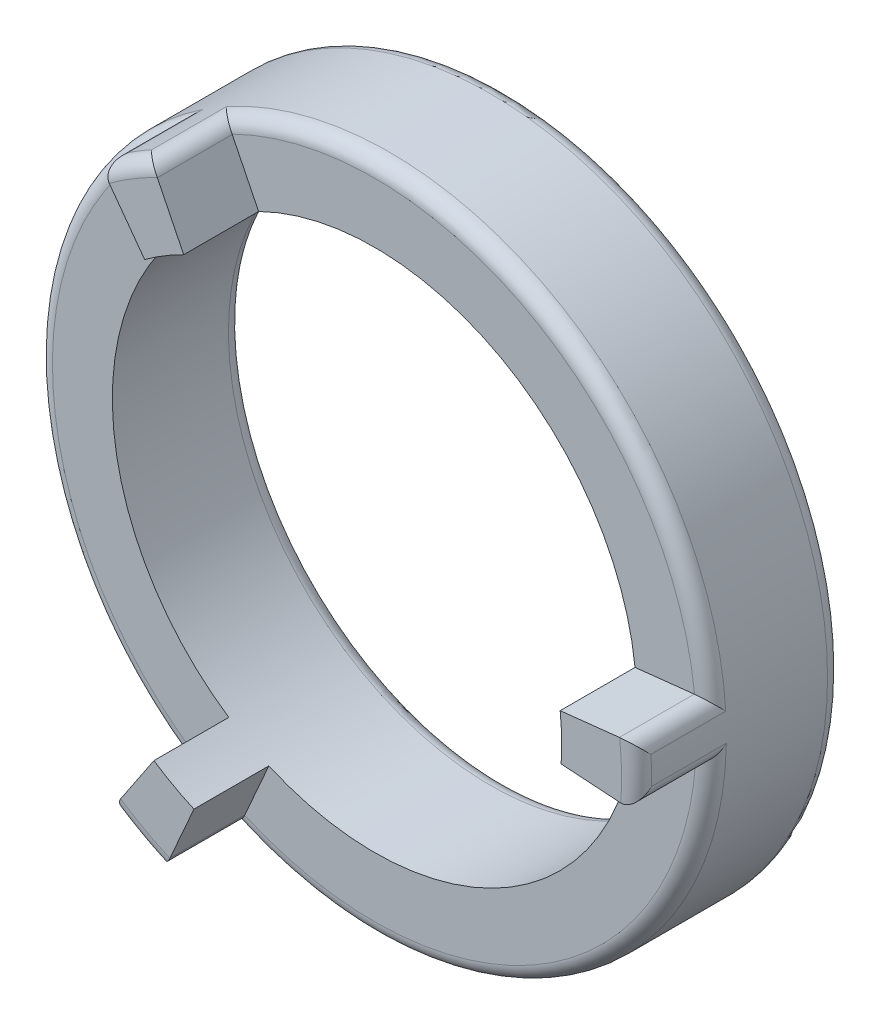
from build123d import *

# Parameters (mm, degrees)
SKETCH_1_R               = 4.5
EXTRUDE_1_DEPTH          = 1.75
SKETCH_2_R               = 3.5
CUT_EXTRUDE_1_DEPTH      = 1.75
EXTRUDE_2_DEPTH          = 1
PATTERN_CIRCULAR_2_COUNT = 3
FILLET_1_R               = 0.2


with BuildPart() as part:
    # 草图1 → 凸台-拉伸1 (new body)
    with BuildSketch(Plane.XY):
        Circle(SKETCH_1_R)
    extrude(amount=EXTRUDE_1_DEPTH)

    # 草图2 → 切除-拉伸1 (cut)
    with BuildSketch(Plane(origin=(0, 0, 0), x_dir=(-1, 0, 0), z_dir=(0, 0, -1))):
        Circle(SKETCH_2_R)
    extrude(amount=-CUT_EXTRUDE_1_DEPTH, mode=Mode.SUBTRACT)

    # 草图3 → 凸台-拉伸2 (add)
    with BuildSketch(Plane.XY.offset(1.75)):
        with BuildLine():
            Line((-1.54722844, 3.139440102), (-1.989293708, 4.036422988))
            ThreePointArc((-1.989293708, 4.036422988), (-2.333521289, 3.84768481), (-2.659989363, 3.629663426))
            Line((-2.659989363, 3.629663426), (-2.068880616, 2.823071554))
            ThreePointArc((-2.068880616, 2.823071554), (-1.814961002, 2.992643741), (-1.54722844, 3.139440102))
        make_face()
    extrude_2 = extrude(amount=EXTRUDE_2_DEPTH)

    # 阵列(圆周)2: 凸台-拉伸2 ×3 about axis
    pattern_circular_2_axis = Axis((0, 0, 0), (0, 0, 1))
    for i in range(1, PATTERN_CIRCULAR_2_COUNT):
        add(extrude_2.rotate(pattern_circular_2_axis, i * 360 / PATTERN_CIRCULAR_2_COUNT))

    # 圆角1
    # the kernel refuses this fillet: 0.2 mm, written as the material it takes off along each edge
    with BuildSketch(Plane(origin=(0, 0, 1.75), x_dir=(-0.5911087473826521, 0.8065918724904882, 0), z_dir=(0.8065918724904882, 0.5911087473826521, 0))) as fillet_1_piece_1:
        with BuildLine():
            CenterArc((4.5 - FILLET_1_R, -FILLET_1_R), FILLET_1_R, 0, 90)
            Line((4.5 - FILLET_1_R, 0), (4.5, 0))
            Line((4.5, 0), (4.5, -FILLET_1_R))
        make_face()
    revolve(axis=Axis((0, 0, 1.75), (0, 0, 1)), revolution_arc=110, mode=Mode.SUBTRACT)
    with BuildSketch(Plane(origin=(-1.989293708, 4.036422988, 1.75), x_dir=(-0.8864567929305034, -0.4628113592678625, 0), z_dir=(0, 0, 1)), Plane(origin=(4.490291703, -0.295432607, 1.75), x_dir=(0.042422002179279744, 0.9990997816690289, 0), z_dir=(0, 0, 1)), Plane(origin=(-2.500997994, -3.740990381, 1.75), x_dir=(0.8440347907512271, -0.5362884224011667, 0), z_dir=(0, 0, 1))) as fillet_1_piece_2:
        with BuildLine():
            CenterArc((0.204706556, 0.19994588), FILLET_1_R, 178.667059118, 92.665881765)
            Line((0.004760676, 0.204598302), (0, 0))
            ThreePointArc((0, 0), (0.104679489, -0.001217698), (0.209358978, 0))
        make_face()
    extrude(amount=1.523397445, mode=Mode.SUBTRACT)
    with BuildSketch(Plane(origin=(-2.659989363, 3.629663426, 1.75), x_dir=(0.820124045079819, 0.5721857658854467, 0), z_dir=(0, 0, 1)), Plane(origin=(4.473375416, 0.488786649, 1.75), x_dir=(0.08546538640074963, -0.9963411402362999, 0), z_dir=(0, 0, 1)), Plane(origin=(-1.813386053, -4.118450075, 1.75), x_dir=(-0.905589431480564, 0.4241553743508489, 0), z_dir=(0, 0, 1))) as fillet_1_piece_3:
        with BuildLine():
            CenterArc((0.204706556, -0.19994588), FILLET_1_R, 88.667059118, 92.665881765)
            Line((0.004760676, -0.204598302), (0, 0))
            ThreePointArc((0, 0), (0.104679489, 0.001217698), (0.209358978, 0))
        make_face()
    extrude(amount=1.523397445, mode=Mode.SUBTRACT)
    with BuildSketch(Plane(origin=(0, 0, 2.75), x_dir=(-0.3398789385562205, 0.9404691952030628, 0), z_dir=(0.9404691952030628, 0.3398789385562205, 0))) as fillet_1_piece_4:
        with BuildLine():
            CenterArc((4.5 - FILLET_1_R, -FILLET_1_R), FILLET_1_R, 0, 90)
            Line((4.5 - FILLET_1_R, 0), (4.5, 0))
            Line((4.5, 0), (4.5, -FILLET_1_R))
        make_face()
    revolve(axis=Axis((0, 0, 2.75), (0, 0, 1)), revolution_arc=22.732458574, mode=Mode.SUBTRACT)
    with BuildSketch(Plane(origin=(0, 0, 0), x_dir=(1, 0, 0), z_dir=(0, -1, 0))) as fillet_1_piece_5:
        with BuildLine():
            CenterArc((4.5 - FILLET_1_R, FILLET_1_R), FILLET_1_R, 270, 90)
            Line((4.5 - FILLET_1_R, 0), (4.5, 0))
            Line((4.5, 0), (4.5, FILLET_1_R))
        make_face()
    revolve(axis=Axis((0, 0, 0), (0, 0, 1)), mode=Mode.SUBTRACT)
    with BuildSketch(Plane(origin=(0, 0, 1.75), x_dir=(0.9940834257541477, 0.1086192553873306, 0), z_dir=(0.1086192553873306, -0.9940834257541477, 0))) as fillet_1_piece_6:
        with BuildLine():
            CenterArc((4.5 - FILLET_1_R, -FILLET_1_R), FILLET_1_R, 0, 90)
            Line((4.5 - FILLET_1_R, 0), (4.5, 0))
            Line((4.5, 0), (4.5, -FILLET_1_R))
        make_face()
    revolve(axis=Axis((0, 0, 1.75), (0, 0, 1)), revolution_arc=110, mode=Mode.SUBTRACT)
    with BuildSketch(Plane(origin=(0, 0, 2.75), x_dir=(0.9844096838006688, -0.17589080260055465, 0), z_dir=(-0.17589080260055465, -0.9844096838006688, 0))) as fillet_1_piece_7:
        with BuildLine():
            CenterArc((4.5 - FILLET_1_R, -FILLET_1_R), FILLET_1_R, 0, 90)
            Line((4.5 - FILLET_1_R, 0), (4.5, 0))
            Line((4.5, 0), (4.5, -FILLET_1_R))
        make_face()
    revolve(axis=Axis((0, 0, 2.75), (0, 0, 1)), revolution_arc=22.732458574, mode=Mode.SUBTRACT)
    with BuildSketch(Plane(origin=(0, 0, 1.75), x_dir=(-0.40297467837149564, -0.9152111278778191, 0), z_dir=(-0.9152111278778191, 0.40297467837149564, 0))) as fillet_1_piece_8:
        with BuildLine():
            CenterArc((4.5 - FILLET_1_R, -FILLET_1_R), FILLET_1_R, 0, 90)
            Line((4.5 - FILLET_1_R, 0), (4.5, 0))
            Line((4.5, 0), (4.5, -FILLET_1_R))
        make_face()
    revolve(axis=Axis((0, 0, 1.75), (0, 0, 1)), revolution_arc=110, mode=Mode.SUBTRACT)
    with BuildSketch(Plane(origin=(0, 0, 2.75), x_dir=(-0.6445307452444484, -0.7645783926025087, 0), z_dir=(-0.7645783926025087, 0.6445307452444484, 0))) as fillet_1_piece_9:
        with BuildLine():
            CenterArc((4.5 - FILLET_1_R, -FILLET_1_R), FILLET_1_R, 0, 90)
            Line((4.5 - FILLET_1_R, 0), (4.5, 0))
            Line((4.5, 0), (4.5, -FILLET_1_R))
        make_face()
    revolve(axis=Axis((0, 0, 2.75), (0, 0, 1)), revolution_arc=22.732458574, mode=Mode.SUBTRACT)
    with BuildSketch(Plane(origin=(0, 0, 0), x_dir=(-1, 0, 0), z_dir=(0, -1, 0))) as fillet_1_piece_10:
        with BuildLine():
            CenterArc((3.5 + FILLET_1_R, -FILLET_1_R), FILLET_1_R, 90, 90)
            Line((3.5, -FILLET_1_R), (3.5, 0))
            Line((3.5, 0), (3.5 + FILLET_1_R, 0))
        make_face()
    revolve(axis=Axis((0, 0, 0), (0, 0, -1)), mode=Mode.SUBTRACT)
    with BuildSketch(Plane(origin=(-2.659989363, 3.629663426, 1.226602555), x_dir=(0.8201240450798175, 0.5721857658854486, 0), z_dir=(0, 0, 1))) as fillet_1_piece_11a_section:
        with BuildLine():
            CenterArc((0.204706556, -0.19994588), FILLET_1_R, 88.667059118, 92.665881765)
            Line((0.004760676, -0.204598302), (0, 0))
            ThreePointArc((0, 0), (0.104679489, 0.001217698), (0.209358978, 0))
        make_face()
    fillet_1_piece_11a = extrude(amount=2.04679489, mode=Mode.PRIVATE)
    fillet_1_piece_11a = split(fillet_1_piece_11a, bisect_by=Plane(origin=(-2.59395086, 3.620118338, 1.75), z_dir=(0, 0, -1)), keep=Keep.TOP, mode=Mode.PRIVATE)
    with BuildSketch(Plane(origin=(0, 0, 1.75), x_dir=(-0.4979688255106006, 0.8671949312695462, 0), z_dir=(0.8671949312695462, 0.4979688255106006, 0))) as fillet_1_piece_11b_section:
        with BuildLine():
            CenterArc((4.5 - FILLET_1_R, -FILLET_1_R), FILLET_1_R, 0, 90)
            Line((4.5 - FILLET_1_R, 0), (4.5, 0))
            Line((4.5, 0), (4.5, -FILLET_1_R))
        make_face()
    fillet_1_piece_11b = revolve(axis=Axis((0, 0, 1.75), (0, 0, 1)), revolution_arc=116.370018498, mode=Mode.PRIVATE)
    fillet_1_piece_11b = split(fillet_1_piece_11b, bisect_by=Plane(origin=(-2.628049402, 3.586080053, 1.704474437), z_dir=(0.8065918724904881, 0.5911087473826522, 0)), keep=Keep.TOP, mode=Mode.PRIVATE)
    fillet_1_piece_11 = fillet_1_piece_11a & fillet_1_piece_11b
    add(fillet_1_piece_11, mode=Mode.SUBTRACT)
    with BuildSketch(Plane(origin=(0, 0, 1.75), x_dir=(-0.5911087473826521, 0.8065918724904882, 0), z_dir=(0.8065918724904882, 0.5911087473826521, 0))) as fillet_1_piece_12a_section:
        with BuildLine():
            CenterArc((4.5 - FILLET_1_R, -FILLET_1_R), FILLET_1_R, 0, 90)
            Line((4.5 - FILLET_1_R, 0), (4.5, 0))
            Line((4.5, 0), (4.5, -FILLET_1_R))
        make_face()
    fillet_1_piece_12a = revolve(axis=Axis((0, 0, 1.75), (0, 0, 1)), revolution_arc=116.370018498, mode=Mode.PRIVATE)
    fillet_1_piece_12a = split(fillet_1_piece_12a, bisect_by=Plane(origin=(-2.47096713, -3.696070243, 1.704474437), z_dir=(0.8313311958319957, -0.5557773320643297, 0)), keep=Keep.TOP, mode=Mode.PRIVATE)
    with BuildSketch(Plane(origin=(-2.500997994, -3.740990381, 1.226602555), x_dir=(0.8440347907512287, -0.5362884224011644, 0), z_dir=(0, 0, 1))) as fillet_1_piece_12b_section:
        with BuildLine():
            CenterArc((0.204706556, 0.19994588), FILLET_1_R, 178.667059118, 92.665881765)
            Line((0.004760676, 0.204598302), (0, 0))
            ThreePointArc((0, 0), (0.104679489, -0.001217698), (0.209358978, 0))
        make_face()
    fillet_1_piece_12b = extrude(amount=2.04679489, mode=Mode.PRIVATE)
    fillet_1_piece_12b = split(fillet_1_piece_12b, bisect_by=Plane(origin=(-2.435432519, -3.728606481, 1.75), z_dir=(0, 0, -1)), keep=Keep.TOP, mode=Mode.PRIVATE)
    fillet_1_piece_12 = fillet_1_piece_12a & fillet_1_piece_12b
    add(fillet_1_piece_12, mode=Mode.SUBTRACT)
    with BuildSketch(Plane(origin=(0, 0, 1.75), x_dir=(0.9940834257541477, 0.1086192553873306, 0), z_dir=(0.1086192553873306, -0.9940834257541477, 0))) as fillet_1_piece_13a_section:
        with BuildLine():
            CenterArc((4.5 - FILLET_1_R, -FILLET_1_R), FILLET_1_R, 0, 90)
            Line((4.5 - FILLET_1_R, 0), (4.5, 0))
            Line((4.5, 0), (4.5, -FILLET_1_R))
        make_face()
    fillet_1_piece_13a = revolve(axis=Axis((0, 0, 1.75), (0, 0, 1)), revolution_arc=116.370018498, mode=Mode.PRIVATE)
    fillet_1_piece_13a = split(fillet_1_piece_13a, bisect_by=Plane(origin=(-1.96540716, 3.987955428, 1.704474437), z_dir=(-0.8969828863312469, -0.44206526851683975, 0)), keep=Keep.TOP, mode=Mode.PRIVATE)
    with BuildSketch(Plane(origin=(-1.989293708, 4.036422988, 1.226602555), x_dir=(-0.886456792930503, -0.4628113592678634, 0), z_dir=(0, 0, 1))) as fillet_1_piece_13b_section:
        with BuildLine():
            CenterArc((0.204706556, 0.19994588), FILLET_1_R, 178.667059118, 92.665881765)
            Line((0.004760676, 0.204598302), (0, 0))
            ThreePointArc((0, 0), (0.104679489, -0.001217698), (0.209358978, 0))
        make_face()
    fillet_1_piece_13b = extrude(amount=2.04679489, mode=Mode.PRIVATE)
    fillet_1_piece_13b = split(fillet_1_piece_13b, bisect_by=Plane(origin=(-2.011351674, 3.973449671, 1.75), z_dir=(0, 0, -1)), keep=Keep.TOP, mode=Mode.PRIVATE)
    fillet_1_piece_13 = fillet_1_piece_13a & fillet_1_piece_13b
    add(fillet_1_piece_13, mode=Mode.SUBTRACT)
    with BuildSketch(Plane(origin=(4.473375416, 0.488786649, 1.226602555), x_dir=(0.0854653864007455, -0.9963411402363004, 0), z_dir=(0, 0, 1))) as fillet_1_piece_14a_section:
        with BuildLine():
            CenterArc((0.204706556, -0.19994588), FILLET_1_R, 88.667059118, 92.665881765)
            Line((0.004760676, -0.204598302), (0, 0))
            ThreePointArc((0, 0), (0.104679489, 0.001217698), (0.209358978, 0))
        make_face()
    fillet_1_piece_14a = extrude(amount=2.04679489, mode=Mode.PRIVATE)
    fillet_1_piece_14a = split(fillet_1_piece_14a, bisect_by=Plane(origin=(4.432089875, 0.436368172, 1.75), z_dir=(0, 0, -1)), keep=Keep.TOP, mode=Mode.PRIVATE)
    with BuildSketch(Plane(origin=(0, 0, 1.75), x_dir=(0.9999972532678275, -0.0023438124498927643, 0), z_dir=(-0.0023438124498927643, -0.9999972532678275, 0))) as fillet_1_piece_14b_section:
        with BuildLine():
            CenterArc((4.5 - FILLET_1_R, -FILLET_1_R), FILLET_1_R, 0, 90)
            Line((4.5 - FILLET_1_R, 0), (4.5, 0))
            Line((4.5, 0), (4.5, -FILLET_1_R))
        make_face()
    fillet_1_piece_14b = revolve(axis=Axis((0, 0, 1.75), (0, 0, 1)), revolution_arc=116.370018498, mode=Mode.PRIVATE)
    fillet_1_piece_14b = split(fillet_1_piece_14b, bisect_by=Plane(origin=(4.419661127, 0.482917518, 1.704474437), z_dir=(0.10861925538733055, -0.9940834257541478, 0)), keep=Keep.TOP, mode=Mode.PRIVATE)
    fillet_1_piece_14 = fillet_1_piece_14a & fillet_1_piece_14b
    add(fillet_1_piece_14, mode=Mode.SUBTRACT)
    with BuildSketch(Plane(origin=(4.490291703, -0.295432607, 1.226602555), x_dir=(0.04242200217927562, 0.999099781669029, 0), z_dir=(0, 0, 1))) as fillet_1_piece_15a_section:
        with BuildLine():
            CenterArc((0.204706556, 0.19994588), FILLET_1_R, 178.667059118, 92.665881765)
            Line((0.004760676, 0.204598302), (0, 0))
            ThreePointArc((0, 0), (0.104679489, -0.001217698), (0.209358978, 0))
        make_face()
    fillet_1_piece_15a = extrude(amount=2.04679489, mode=Mode.PRIVATE)
    fillet_1_piece_15a = split(fillet_1_piece_15a, bisect_by=Plane(origin=(4.446784193, -0.24484319, 1.75), z_dir=(0, 0, -1)), keep=Keep.TOP, mode=Mode.PRIVATE)
    with BuildSketch(Plane(origin=(0, 0, 1.75), x_dir=(-0.40297467837149564, -0.9152111278778191, 0), z_dir=(-0.9152111278778191, 0.40297467837149564, 0))) as fillet_1_piece_15b_section:
        with BuildLine():
            CenterArc((4.5 - FILLET_1_R, -FILLET_1_R), FILLET_1_R, 0, 90)
            Line((4.5 - FILLET_1_R, 0), (4.5, 0))
            Line((4.5, 0), (4.5, -FILLET_1_R))
        make_face()
    fillet_1_piece_15b = revolve(axis=Axis((0, 0, 1.75), (0, 0, 1)), revolution_arc=116.370018498, mode=Mode.PRIVATE)
    fillet_1_piece_15b = split(fillet_1_piece_15b, bisect_by=Plane(origin=(4.43637429, -0.291885185, 1.704474437), z_dir=(0.06565169049925154, 0.9978426005811692, 0)), keep=Keep.TOP, mode=Mode.PRIVATE)
    fillet_1_piece_15 = fillet_1_piece_15a & fillet_1_piece_15b
    add(fillet_1_piece_15, mode=Mode.SUBTRACT)
    with BuildSketch(Plane(origin=(0, 0, 1.75), x_dir=(-0.5020284277572276, -0.8648511188196534, 0), z_dir=(-0.8648511188196534, 0.5020284277572276, 0))) as fillet_1_piece_16a_section:
        with BuildLine():
            CenterArc((4.5 - FILLET_1_R, -FILLET_1_R), FILLET_1_R, 0, 90)
            Line((4.5 - FILLET_1_R, 0), (4.5, 0))
            Line((4.5, 0), (4.5, -FILLET_1_R))
        make_face()
    fillet_1_piece_16a = revolve(axis=Axis((0, 0, 1.75), (0, 0, 1)), revolution_arc=116.370018498, mode=Mode.PRIVATE)
    fillet_1_piece_16a = split(fillet_1_piece_16a, bisect_by=Plane(origin=(-1.791611725, -4.068997571, 1.704474437), z_dir=(-0.9152111278778191, 0.40297467837149553, 0)), keep=Keep.TOP, mode=Mode.PRIVATE)
    with BuildSketch(Plane(origin=(-1.813386053, -4.118450075, 1.226602555), x_dir=(-0.9055894314805639, 0.4241553743508493, 0), z_dir=(0, 0, 1))) as fillet_1_piece_16b_section:
        with BuildLine():
            CenterArc((0.204706556, -0.19994588), FILLET_1_R, 88.667059118, 92.665881765)
            Line((0.004760676, -0.204598302), (0, 0))
            ThreePointArc((0, 0), (0.104679489, 0.001217698), (0.209358978, 0))
        make_face()
    fillet_1_piece_16b = extrude(amount=2.04679489, mode=Mode.PRIVATE)
    fillet_1_piece_16b = split(fillet_1_piece_16b, bisect_by=Plane(origin=(-1.838139015, -4.05648651, 1.75), z_dir=(0, 0, -1)), keep=Keep.TOP, mode=Mode.PRIVATE)
    fillet_1_piece_16 = fillet_1_piece_16a & fillet_1_piece_16b
    add(fillet_1_piece_16, mode=Mode.SUBTRACT)


solid = part.part
